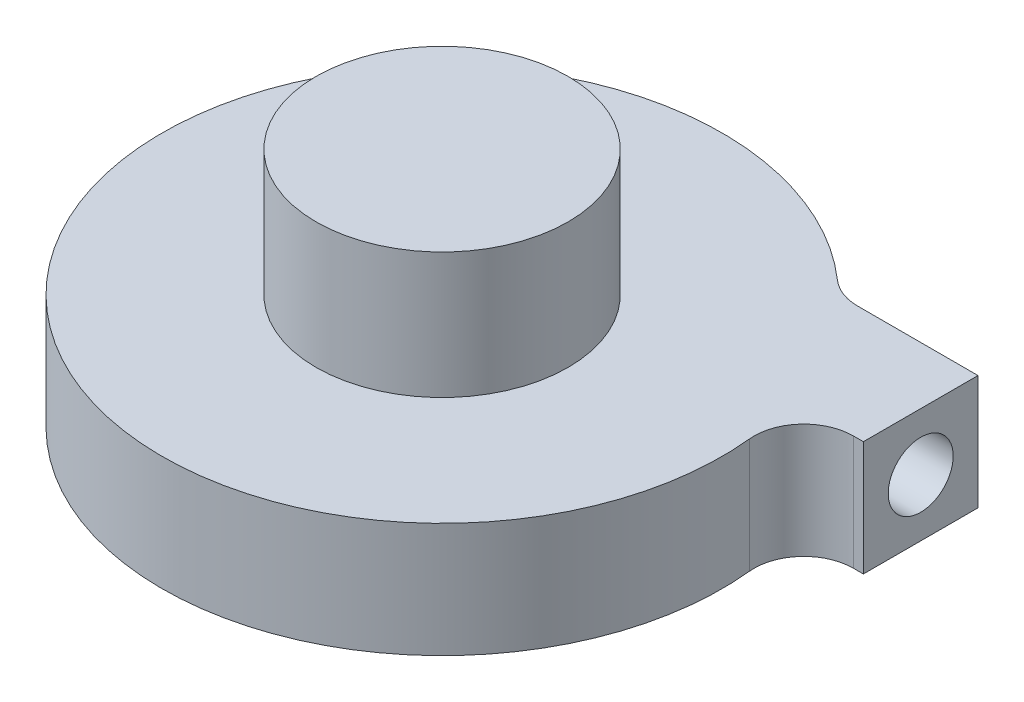
from build123d import *

# Parameters (mm, degrees)
MAIN_BODY_DEPTH     = 23.096875
SKETCH7_R           = 25.4
BOSS_EXTRUDE1_DEPTH = 25.4


with BuildPart() as part:
    # Sketch1 → main body (new body)
    with BuildSketch(Plane(origin=(0, 0, 0), x_dir=(1, 0, 0), z_dir=(0, 1, 0))):
        with BuildLine():
            Line((68.11399525, 28.340685), (68.11399525, 39.8891225))
            Line((68.11399525, 39.8891225), (43.893939857, 39.8891225))
            ThreePointArc((43.893939857, 39.8891225), (40.363903471, 40.532903012), (37.288380812, 42.381353877))
            ThreePointArc((37.288380812, 42.381353877), (-50.179489431, -25.857713364), (56.154328242, 5.770088358))
            ThreePointArc((56.154328242, 5.770088358), (58.678286032, 13.492188118), (66.101950606, 16.7922475))
            Line((66.101950606, 16.7922475), (68.11399525, 16.7922475))
            Line((68.11399525, 16.7922475), (68.11399525, 28.340685))
        make_face()
    extrude(amount=MAIN_BODY_DEPTH)

    # Sketch7 → Boss-Extrude1 (add)
    with BuildSketch(Plane(origin=(0, 23.096875, 0), x_dir=(1, 0, 0), z_dir=(0, 1, 0))):
        Circle(SKETCH7_R)
    extrude(amount=BOSS_EXTRUDE1_DEPTH)

    # Sketch3 → expansion cone and outlet (revolve, cut)
    with BuildSketch(Plane(origin=(0, 11.5484375, 0), x_dir=(1, 0, 0), z_dir=(0, 1, 0))):
        Polygon((21.104522505, 30.626685), (0, 30.626685), (0, 28.340685), (2.479488654, 28.340685), (50.11399525, 28.340685), (68.11399525, 28.340685), (68.11399525, 34.8891225), (50.11399525, 34.8891225), (50.11399525, 33.164685), align=None)
    revolve(axis=Axis((50.11399525, 11.5484375, -28.340685), (-1, 0, 0)), mode=Mode.SUBTRACT)

    # Sketch2 → main chamber (revolve, cut)
    with BuildSketch(Plane.XY):
        Polygon((0, 25.041388608), (0, 13.367547379), (0, 10.867547379), (0, 0), (30.626685, 0), (30.626685, 10.867547379), (30.626685, 13.282748541), (30.626685, 13.8344375), (5.4102, 25.593077567), (0, 25.593077567), align=None)
    revolve(axis=Axis((0, 25.041388608, 0), (0, -1, 0)), mode=Mode.SUBTRACT)


solid = part.part
